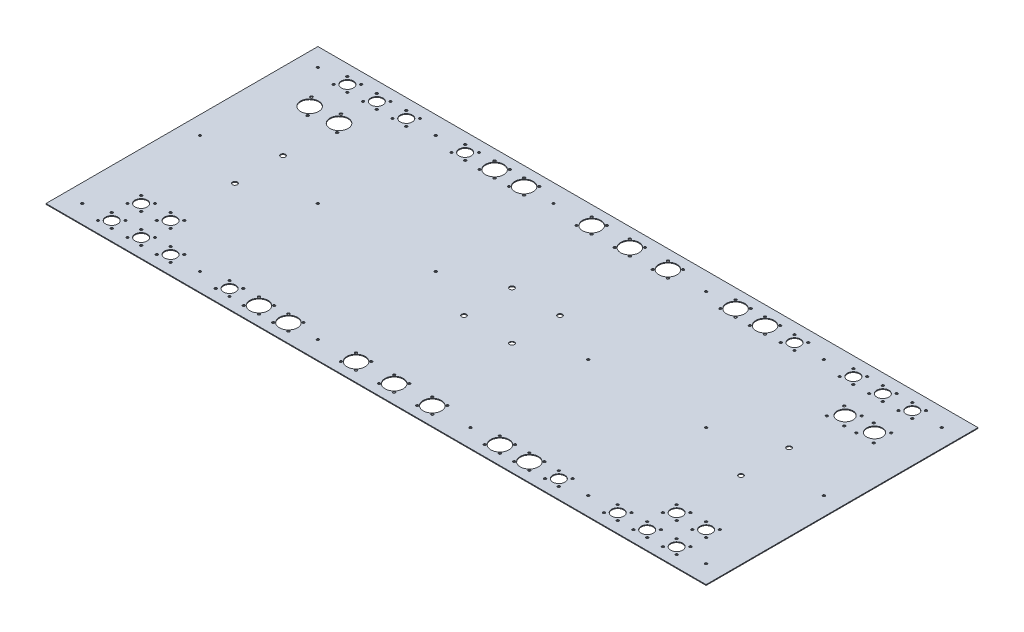
from build123d import *

# Parameters (mm, degrees)
MAIN_PLATE_W        = 874
MAIN_PLATE_H        = 360
BOSS_EXTRUDE1_DEPTH = 1.016
SKETCH2_R           = 1.6
SKETCH2_R_2         = 3.175
CUT_EXTRUDE1_DEPTH  = 473.620389167
FAN_R               = 1.6
FAN_R_2             = 12
CUT_EXTRUDE2_DEPTH  = 474.008271082
NTYPE_R             = 8
NTYPE_R_2           = 1.6
CUT_EXTRUDE3_DEPTH  = 473.620389167
ETHERNET_R          = 12
ETHERNET_R_2        = 1.755
CUT_EXTRUDE6_DEPTH  = 10
POWER_R             = 10.4521
POWER_R_2           = 1.5875
CUT_EXTRUDE7_DEPTH  = 10


with BuildPart() as part:
    # main_plate → Boss-Extrude1 (new body)
    with BuildSketch(Plane(origin=(0, 0, 0), x_dir=(1, 0, 0), z_dir=(0, 1, 0))):
        Rectangle(MAIN_PLATE_W, MAIN_PLATE_H)
    extrude(amount=BOSS_EXTRUDE1_DEPTH)

    # Sketch2 → Cut-Extrude1 (cut, through all)
    with BuildSketch(Plane(origin=(0, 1.016, 0), x_dir=(1, 0, 0), z_dir=(0, 1, 0))):
        with Locations((-413, 156)):
            Circle(SKETCH2_R)
        with Locations((-335, 31.805896398)):
            Circle(SKETCH2_R_2)
        with Locations((-335, -31.805896398)):
            Circle(SKETCH2_R_2)
        with Locations((-257, 156)):
            Circle(SKETCH2_R)
        with Locations((-101, 156)):
            Circle(SKETCH2_R)
        with Locations((-257, 0)):
            Circle(SKETCH2_R)
        with Locations((-101, 0)):
            Circle(SKETCH2_R)
        with Locations((-257, -156)):
            Circle(SKETCH2_R)
        with Locations((-101, -156)):
            Circle(SKETCH2_R)
        with Locations((-413, 0)):
            Circle(SKETCH2_R)
        with Locations((-413, -156)):
            Circle(SKETCH2_R)
        with Locations((-31.75, 31.75)):
            Circle(SKETCH2_R_2)
        with Locations((-31.75, -31.75)):
            Circle(SKETCH2_R_2)
        with Locations((31.75, -31.75)):
            Circle(SKETCH2_R_2)
        with Locations((31.75, 31.75)):
            Circle(SKETCH2_R_2)
        with Locations((413, -156)):
            Circle(SKETCH2_R)
        with Locations((413, 0)):
            Circle(SKETCH2_R)
        with Locations((101, -156)):
            Circle(SKETCH2_R)
        with Locations((257, -156)):
            Circle(SKETCH2_R)
        with Locations((101, 0)):
            Circle(SKETCH2_R)
        with Locations((257, 0)):
            Circle(SKETCH2_R)
        with Locations((101, 156)):
            Circle(SKETCH2_R)
        with Locations((257, 156)):
            Circle(SKETCH2_R)
        with Locations((335, -31.805896398)):
            Circle(SKETCH2_R_2)
        with Locations((335, 31.805896398)):
            Circle(SKETCH2_R_2)
        with Locations((413, 156)):
            Circle(SKETCH2_R)
    extrude(amount=-CUT_EXTRUDE1_DEPTH, mode=Mode.SUBTRACT)

    # fan → Cut-Extrude2 (cut, through all)
    with BuildSketch(Plane(origin=(0, 1.016, 1.016), x_dir=(1, 0, 0), z_dir=(0, 1, 0))):
        with Locations((130, -144.984)):
            Circle(FAN_R)
        with Locations((150, -144.984)):
            Circle(FAN_R)
        with Locations((150, -164.984)):
            Circle(FAN_R)
        with Locations((130, -164.984)):
            Circle(FAN_R)
        with Locations((140, -154.984)):
            Circle(FAN_R_2)
        with Locations((169, -144.984)):
            Circle(FAN_R)
        with Locations((189, -144.984)):
            Circle(FAN_R)
        with Locations((189, -164.984)):
            Circle(FAN_R)
        with Locations((169, -164.984)):
            Circle(FAN_R)
        with Locations((179, -154.984)):
            Circle(FAN_R_2)
        with Locations((-10, -144.984)):
            Circle(FAN_R)
        with Locations((10, -144.984)):
            Circle(FAN_R)
        with Locations((10, -164.984)):
            Circle(FAN_R)
        with Locations((-10, -164.984)):
            Circle(FAN_R)
        with Locations((0, -154.984)):
            Circle(FAN_R_2)
        with Locations((-60.5, -144.984)):
            Circle(FAN_R)
        with Locations((-40.5, -144.984)):
            Circle(FAN_R)
        with Locations((-40.5, -164.984)):
            Circle(FAN_R)
        with Locations((-60.5, -164.984)):
            Circle(FAN_R)
        with Locations((-50.5, -154.984)):
            Circle(FAN_R_2)
        with Locations((40.5, -144.984)):
            Circle(FAN_R)
        with Locations((60.5, -144.984)):
            Circle(FAN_R)
        with Locations((60.5, -164.984)):
            Circle(FAN_R)
        with Locations((40.5, -164.984)):
            Circle(FAN_R)
        with Locations((50.5, -154.984)):
            Circle(FAN_R_2)
        with Locations((-10, 167.016)):
            Circle(FAN_R)
        with Locations((10, 167.016)):
            Circle(FAN_R)
        with Locations((10, 147.016)):
            Circle(FAN_R)
        with Locations((-10, 147.016)):
            Circle(FAN_R)
        with Locations((0, 157.016)):
            Circle(FAN_R_2)
        with Locations((-60.5, 167.016)):
            Circle(FAN_R)
        with Locations((-40.5, 167.016)):
            Circle(FAN_R)
        with Locations((-40.5, 147.016)):
            Circle(FAN_R)
        with Locations((-60.5, 147.016)):
            Circle(FAN_R)
        with Locations((-50.5, 157.016)):
            Circle(FAN_R_2)
        with Locations((40.5, 167.016)):
            Circle(FAN_R)
        with Locations((60.5, 167.016)):
            Circle(FAN_R)
        with Locations((60.5, 147.016)):
            Circle(FAN_R)
        with Locations((40.5, 147.016)):
            Circle(FAN_R)
        with Locations((50.5, 157.016)):
            Circle(FAN_R_2)
        with Locations((-189, -144.984)):
            Circle(FAN_R)
        with Locations((-169, -144.984)):
            Circle(FAN_R)
        with Locations((-169, -164.984)):
            Circle(FAN_R)
        with Locations((-189, -164.984)):
            Circle(FAN_R)
        with Locations((-179, -154.984)):
            Circle(FAN_R_2)
        with Locations((-150, -144.984)):
            Circle(FAN_R)
        with Locations((-130, -144.984)):
            Circle(FAN_R)
        with Locations((-130, -164.984)):
            Circle(FAN_R)
        with Locations((-150, -164.984)):
            Circle(FAN_R)
        with Locations((-140, -154.984)):
            Circle(FAN_R_2)
        with Locations((-189, 167.016)):
            Circle(FAN_R)
        with Locations((-169, 167.016)):
            Circle(FAN_R)
        with Locations((-169, 147.016)):
            Circle(FAN_R)
        with Locations((-189, 147.016)):
            Circle(FAN_R)
        with Locations((-179, 157.016)):
            Circle(FAN_R_2)
        with Locations((-150, 167.016)):
            Circle(FAN_R)
        with Locations((-130, 167.016)):
            Circle(FAN_R)
        with Locations((-130, 147.016)):
            Circle(FAN_R)
        with Locations((-150, 147.016)):
            Circle(FAN_R)
        with Locations((-140, 157.016)):
            Circle(FAN_R_2)
        with Locations((130, 167.016)):
            Circle(FAN_R)
        with Locations((150, 167.016)):
            Circle(FAN_R)
        with Locations((150, 147.016)):
            Circle(FAN_R)
        with Locations((130, 147.016)):
            Circle(FAN_R)
        with Locations((140, 157.016)):
            Circle(FAN_R_2)
        with Locations((169, 167.016)):
            Circle(FAN_R)
        with Locations((189, 167.016)):
            Circle(FAN_R)
        with Locations((189, 147.016)):
            Circle(FAN_R)
        with Locations((169, 147.016)):
            Circle(FAN_R)
        with Locations((179, 157.016)):
            Circle(FAN_R_2)
    extrude(amount=-CUT_EXTRUDE2_DEPTH, mode=Mode.SUBTRACT)

    # ntype → Cut-Extrude3 (cut, through all)
    with BuildSketch(Plane(origin=(0, 1.016, 0), x_dir=(1, 0, 0), z_dir=(0, 1, 0))):
        with Locations((-218, 156)):
            Circle(NTYPE_R)
        with Locations((-227.1, 165.1)):
            Circle(NTYPE_R_2)
        with Locations((-208.9, 165.1)):
            Circle(NTYPE_R_2)
        with Locations((-208.9, 146.9)):
            Circle(NTYPE_R_2)
        with Locations((-227.1, 146.9)):
            Circle(NTYPE_R_2)
        with Locations((218, 156)):
            Circle(NTYPE_R)
        with Locations((208.9, 165.1)):
            Circle(NTYPE_R_2)
        with Locations((227.1, 165.1)):
            Circle(NTYPE_R_2)
        with Locations((227.1, 146.9)):
            Circle(NTYPE_R_2)
        with Locations((208.9, 146.9)):
            Circle(NTYPE_R_2)
        with Locations((-218, -156)):
            Circle(NTYPE_R)
        with Locations((-227.1, -146.9)):
            Circle(NTYPE_R_2)
        with Locations((-208.9, -146.9)):
            Circle(NTYPE_R_2)
        with Locations((-208.9, -165.1)):
            Circle(NTYPE_R_2)
        with Locations((-227.1, -165.1)):
            Circle(NTYPE_R_2)
        with Locations((218, -156)):
            Circle(NTYPE_R)
        with Locations((208.9, -146.9)):
            Circle(NTYPE_R_2)
        with Locations((227.1, -146.9)):
            Circle(NTYPE_R_2)
        with Locations((227.1, -165.1)):
            Circle(NTYPE_R_2)
        with Locations((208.9, -165.1)):
            Circle(NTYPE_R_2)
        with Locations((-374, 156)):
            Circle(NTYPE_R)
        with Locations((-383.1, 165.1)):
            Circle(NTYPE_R_2)
        with Locations((-364.9, 165.1)):
            Circle(NTYPE_R_2)
        with Locations((-364.9, 146.9)):
            Circle(NTYPE_R_2)
        with Locations((-383.1, 146.9)):
            Circle(NTYPE_R_2)
        with Locations((-296, 156)):
            Circle(NTYPE_R)
        with Locations((-305.1, 165.1)):
            Circle(NTYPE_R_2)
        with Locations((-286.9, 165.1)):
            Circle(NTYPE_R_2)
        with Locations((-286.9, 146.9)):
            Circle(NTYPE_R_2)
        with Locations((-305.1, 146.9)):
            Circle(NTYPE_R_2)
        with Locations((-335, 156)):
            Circle(NTYPE_R)
        with Locations((-344.1, 165.1)):
            Circle(NTYPE_R_2)
        with Locations((-325.9, 165.1)):
            Circle(NTYPE_R_2)
        with Locations((-325.9, 146.9)):
            Circle(NTYPE_R_2)
        with Locations((-344.1, 146.9)):
            Circle(NTYPE_R_2)
        with Locations((296, -156)):
            Circle(NTYPE_R)
        with Locations((286.9, -146.9)):
            Circle(NTYPE_R_2)
        with Locations((305.1, -146.9)):
            Circle(NTYPE_R_2)
        with Locations((305.1, -165.1)):
            Circle(NTYPE_R_2)
        with Locations((286.9, -165.1)):
            Circle(NTYPE_R_2)
        with Locations((374, -156)):
            Circle(NTYPE_R)
        with Locations((364.9, -146.9)):
            Circle(NTYPE_R_2)
        with Locations((383.1, -146.9)):
            Circle(NTYPE_R_2)
        with Locations((383.1, -165.1)):
            Circle(NTYPE_R_2)
        with Locations((364.9, -165.1)):
            Circle(NTYPE_R_2)
        with Locations((335, -156)):
            Circle(NTYPE_R)
        with Locations((325.9, -146.9)):
            Circle(NTYPE_R_2)
        with Locations((344.1, -146.9)):
            Circle(NTYPE_R_2)
        with Locations((344.1, -165.1)):
            Circle(NTYPE_R_2)
        with Locations((325.9, -165.1)):
            Circle(NTYPE_R_2)
        with Locations((296, 156)):
            Circle(NTYPE_R)
        with Locations((286.9, 165.1)):
            Circle(NTYPE_R_2)
        with Locations((305.1, 165.1)):
            Circle(NTYPE_R_2)
        with Locations((305.1, 146.9)):
            Circle(NTYPE_R_2)
        with Locations((286.9, 146.9)):
            Circle(NTYPE_R_2)
        with Locations((374, 156)):
            Circle(NTYPE_R)
        with Locations((364.9, 165.1)):
            Circle(NTYPE_R_2)
        with Locations((383.1, 165.1)):
            Circle(NTYPE_R_2)
        with Locations((383.1, 146.9)):
            Circle(NTYPE_R_2)
        with Locations((364.9, 146.9)):
            Circle(NTYPE_R_2)
        with Locations((335, 156)):
            Circle(NTYPE_R)
        with Locations((325.9, 165.1)):
            Circle(NTYPE_R_2)
        with Locations((344.1, 165.1)):
            Circle(NTYPE_R_2)
        with Locations((344.1, 146.9)):
            Circle(NTYPE_R_2)
        with Locations((325.9, 146.9)):
            Circle(NTYPE_R_2)
        with Locations((-374, -156)):
            Circle(NTYPE_R)
        with Locations((-383.1, -146.9)):
            Circle(NTYPE_R_2)
        with Locations((-364.9, -146.9)):
            Circle(NTYPE_R_2)
        with Locations((-364.9, -165.1)):
            Circle(NTYPE_R_2)
        with Locations((-383.1, -165.1)):
            Circle(NTYPE_R_2)
        with Locations((-296, -156)):
            Circle(NTYPE_R)
        with Locations((-305.1, -146.9)):
            Circle(NTYPE_R_2)
        with Locations((-286.9, -146.9)):
            Circle(NTYPE_R_2)
        with Locations((-286.9, -165.1)):
            Circle(NTYPE_R_2)
        with Locations((-305.1, -165.1)):
            Circle(NTYPE_R_2)
        with Locations((-335, -156)):
            Circle(NTYPE_R)
        with Locations((-344.1, -146.9)):
            Circle(NTYPE_R_2)
        with Locations((-325.9, -146.9)):
            Circle(NTYPE_R_2)
        with Locations((-325.9, -165.1)):
            Circle(NTYPE_R_2)
        with Locations((-344.1, -165.1)):
            Circle(NTYPE_R_2)
        with Locations((-335, -117)):
            Circle(NTYPE_R)
        with Locations((-344.1, -107.9)):
            Circle(NTYPE_R_2)
        with Locations((-325.9, -107.9)):
            Circle(NTYPE_R_2)
        with Locations((-325.9, -126.1)):
            Circle(NTYPE_R_2)
        with Locations((-344.1, -126.1)):
            Circle(NTYPE_R_2)
        with Locations((-374, -117)):
            Circle(NTYPE_R)
        with Locations((-383.1, -107.9)):
            Circle(NTYPE_R_2)
        with Locations((-364.9, -107.9)):
            Circle(NTYPE_R_2)
        with Locations((-364.9, -126.1)):
            Circle(NTYPE_R_2)
        with Locations((-383.1, -126.1)):
            Circle(NTYPE_R_2)
        with Locations((374, -117)):
            Circle(NTYPE_R)
        with Locations((364.9, -107.9)):
            Circle(NTYPE_R_2)
        with Locations((383.1, -107.9)):
            Circle(NTYPE_R_2)
        with Locations((383.1, -126.1)):
            Circle(NTYPE_R_2)
        with Locations((364.9, -126.1)):
            Circle(NTYPE_R_2)
        with Locations((335, -117)):
            Circle(NTYPE_R)
        with Locations((325.9, -107.9)):
            Circle(NTYPE_R_2)
        with Locations((344.1, -107.9)):
            Circle(NTYPE_R_2)
        with Locations((344.1, -126.1)):
            Circle(NTYPE_R_2)
        with Locations((325.9, -126.1)):
            Circle(NTYPE_R_2)
    extrude(amount=-CUT_EXTRUDE3_DEPTH, mode=Mode.SUBTRACT)

    # ethernet → Cut-Extrude6 (cut)
    with BuildSketch(Plane(origin=(0, 1.016, 0), x_dir=(1, 0, 0), z_dir=(0, 1, 0))):
        with Locations((-374, 106)):
            Circle(ETHERNET_R)
        with Locations((-383.5, 118)):
            Circle(ETHERNET_R_2)
        with Locations((-364.5, 94)):
            Circle(ETHERNET_R_2)
        with Locations((-335, 106)):
            Circle(ETHERNET_R)
        with Locations((-344.5, 118)):
            Circle(ETHERNET_R_2)
        with Locations((-325.5, 94)):
            Circle(ETHERNET_R_2)
    extrude(amount=-CUT_EXTRUDE6_DEPTH, mode=Mode.SUBTRACT)

    # power → Cut-Extrude7 (cut)
    with BuildSketch(Plane(origin=(0, 1.016, 0), x_dir=(1, 0, 0), z_dir=(0, 1, 0))):
        with Locations((374, 106)):
            Circle(POWER_R)
        with Locations((362.4938, 116.4521)):
            Circle(POWER_R_2)
        with Locations((385.5062, 116.4521)):
            Circle(POWER_R_2)
        with Locations((385.5062, 93.4397)):
            Circle(POWER_R_2)
        with Locations((362.4938, 93.4397)):
            Circle(POWER_R_2)
        with Locations((335, 106)):
            Circle(POWER_R)
        with Locations((323.4938, 116.4521)):
            Circle(POWER_R_2)
        with Locations((346.5062, 116.4521)):
            Circle(POWER_R_2)
        with Locations((346.5062, 93.4397)):
            Circle(POWER_R_2)
        with Locations((323.4938, 93.4397)):
            Circle(POWER_R_2)
    extrude(amount=-CUT_EXTRUDE7_DEPTH, mode=Mode.SUBTRACT)


solid = part.part
